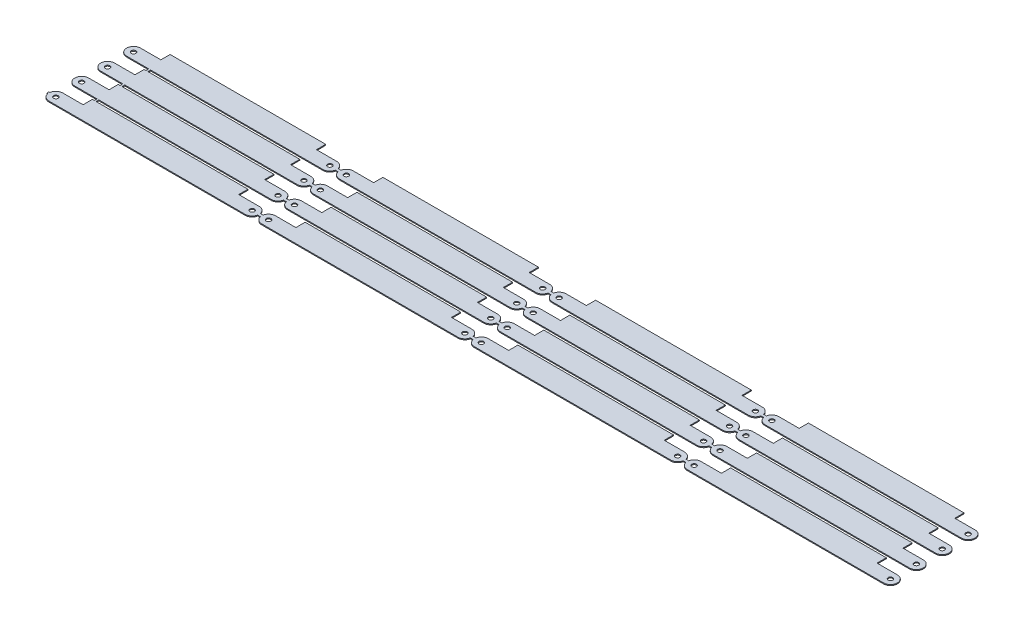
from build123d import *

# Parameters (mm, degrees)
SKETCH1_R           = 2.5
BOSS_EXTRUDE1_DEPTH = 1


with BuildPart() as part:
    # Sketch1 → Boss-Extrude1 (new body)
    with BuildSketch(Plane(origin=(0, 0, 0), x_dir=(1, 0, 0), z_dir=(0, 1, 0))):
        with BuildLine():
            Line((22, 7.5), (0, 7.5))
            ThreePointArc((0, 7.5), (-4.937104415, 5.645794895), (-7.433034374, 1))
            Line((-7.433034374, 1), (-8.5, 1))
            Line((-8.5, 1), (-8.5, -1))
            Line((-8.5, -1), (-7.433034374, -1))
            ThreePointArc((-7.433034374, -1), (-4.937104415, -5.645794895), (0, -7.5))
            Line((0, -7.5), (212.13, -7.5))
            ThreePointArc((212.13, -7.5), (216.87341649, -5.809475019), (219.478469228, -1.5))
            Line((219.478469228, -1.5), (222.551530772, -1.5))
            ThreePointArc((222.551530772, -1.5), (225.15658351, -5.809475019), (229.9, -7.5))
            Line((229.9, -7.5), (442.03, -7.5))
            ThreePointArc((442.03, -7.5), (446.77341649, -5.809475019), (449.378469228, -1.5))
            Line((449.378469228, -1.5), (452.451530772, -1.5))
            ThreePointArc((452.451530772, -1.5), (455.05658351, -5.809475019), (459.8, -7.5))
            Line((459.8, -7.5), (671.93, -7.5))
            ThreePointArc((671.93, -7.5), (676.67341649, -5.809475019), (679.278469228, -1.5))
            Line((679.278469228, -1.5), (682.351530772, -1.5))
            ThreePointArc((682.351530772, -1.5), (684.95658351, -5.809475019), (689.7, -7.5))
            Line((689.7, -7.5), (901.83, -7.5))
            ThreePointArc((901.83, -7.5), (909.33, 0), (901.83, 7.5))
            Line((901.83, 7.5), (879.83, 7.5))
            Line((879.83, 7.5), (879.83, 17.5))
            Line((879.83, 17.5), (711.7, 17.5))
            Line((711.7, 17.5), (711.7, 7.5))
            Line((711.7, 7.5), (689.7, 7.5))
            ThreePointArc((689.7, 7.5), (684.95658351, 5.809475019), (682.351530772, 1.5))
            Line((682.351530772, 1.5), (679.278469228, 1.5))
            ThreePointArc((679.278469228, 1.5), (676.67341649, 5.809475019), (671.93, 7.5))
            Line((671.93, 7.5), (649.93, 7.5))
            Line((649.93, 7.5), (649.93, 17.5))
            Line((649.93, 17.5), (481.8, 17.5))
            Line((481.8, 17.5), (481.8, 7.5))
            Line((481.8, 7.5), (459.8, 7.5))
            ThreePointArc((459.8, 7.5), (455.05658351, 5.809475019), (452.451530772, 1.5))
            Line((452.451530772, 1.5), (449.378469228, 1.5))
            ThreePointArc((449.378469228, 1.5), (446.77341649, 5.809475019), (442.03, 7.5))
            Line((442.03, 7.5), (420.03, 7.5))
            Line((420.03, 7.5), (420.03, 17.5))
            Line((420.03, 17.5), (251.9, 17.5))
            Line((251.9, 17.5), (251.9, 7.5))
            Line((251.9, 7.5), (229.9, 7.5))
            ThreePointArc((229.9, 7.5), (225.15658351, 5.809475019), (222.551530772, 1.5))
            Line((222.551530772, 1.5), (219.478469228, 1.5))
            ThreePointArc((219.478469228, 1.5), (216.87341649, 5.809475019), (212.13, 7.5))
            Line((212.13, 7.5), (190.13, 7.5))
            Line((190.13, 7.5), (190.13, 17.5))
            Line((190.13, 17.5), (26, 17.5))
            Line((26, 17.5), (26, 20.5))
            Line((26, 20.5), (212.13, 20.5))
            ThreePointArc((212.13, 20.5), (216.87341649, 22.190524981), (219.478469228, 26.5))
            Line((219.478469228, 26.5), (222.551530772, 26.5))
            ThreePointArc((222.551530772, 26.5), (225.15658351, 22.190524981), (229.9, 20.5))
            Line((229.9, 20.5), (442.03, 20.5))
            ThreePointArc((442.03, 20.5), (446.77341649, 22.190524981), (449.378469228, 26.5))
            Line((449.378469228, 26.5), (452.451530772, 26.5))
            ThreePointArc((452.451530772, 26.5), (455.05658351, 22.190524981), (459.8, 20.5))
            Line((459.8, 20.5), (671.93, 20.5))
            ThreePointArc((671.93, 20.5), (676.67341649, 22.190524981), (679.278469228, 26.5))
            Line((679.278469228, 26.5), (682.351530772, 26.5))
            ThreePointArc((682.351530772, 26.5), (684.95658351, 22.190524981), (689.7, 20.5))
            Line((689.7, 20.5), (901.83, 20.5))
            ThreePointArc((901.83, 20.5), (909.33, 28), (901.83, 35.5))
            Line((901.83, 35.5), (879.83, 35.5))
            Line((879.83, 35.5), (879.83, 45.5))
            Line((879.83, 45.5), (711.7, 45.5))
            Line((711.7, 45.5), (711.7, 35.5))
            Line((711.7, 35.5), (689.7, 35.5))
            ThreePointArc((689.7, 35.5), (684.95658351, 33.809475019), (682.351530772, 29.5))
            Line((682.351530772, 29.5), (679.278469228, 29.5))
            ThreePointArc((679.278469228, 29.5), (676.67341649, 33.809475019), (671.93, 35.5))
            Line((671.93, 35.5), (649.93, 35.5))
            Line((649.93, 35.5), (649.93, 45.5))
            Line((649.93, 45.5), (481.8, 45.5))
            Line((481.8, 45.5), (481.8, 35.5))
            Line((481.8, 35.5), (459.8, 35.5))
            ThreePointArc((459.8, 35.5), (455.05658351, 33.809475019), (452.451530772, 29.5))
            Line((452.451530772, 29.5), (449.378469228, 29.5))
            ThreePointArc((449.378469228, 29.5), (446.77341649, 33.809475019), (442.03, 35.5))
            Line((442.03, 35.5), (420.03, 35.5))
            Line((420.03, 35.5), (420.03, 45.5))
            Line((420.03, 45.5), (251.9, 45.5))
            Line((251.9, 45.5), (251.9, 35.5))
            Line((251.9, 35.5), (229.9, 35.5))
            ThreePointArc((229.9, 35.5), (225.15658351, 33.809475019), (222.551530772, 29.5))
            Line((222.551530772, 29.5), (219.478469228, 29.5))
            ThreePointArc((219.478469228, 29.5), (216.87341649, 33.809475019), (212.13, 35.5))
            Line((212.13, 35.5), (190.13, 35.5))
            Line((190.13, 35.5), (190.13, 45.5))
            Line((190.13, 45.5), (26, 45.5))
            Line((26, 45.5), (26, 48.5))
            Line((26, 48.5), (212.13, 48.5))
            ThreePointArc((212.13, 48.5), (216.87341649, 50.190524981), (219.478469228, 54.5))
            Line((219.478469228, 54.5), (222.551530772, 54.5))
            ThreePointArc((222.551530772, 54.5), (225.15658351, 50.190524981), (229.9, 48.5))
            Line((229.9, 48.5), (442.03, 48.5))
            ThreePointArc((442.03, 48.5), (446.77341649, 50.190524981), (449.378469228, 54.5))
            Line((449.378469228, 54.5), (452.451530772, 54.5))
            ThreePointArc((452.451530772, 54.5), (455.05658351, 50.190524981), (459.8, 48.5))
            Line((459.8, 48.5), (671.93, 48.5))
            ThreePointArc((671.93, 48.5), (676.67341649, 50.190524981), (679.278469228, 54.5))
            Line((679.278469228, 54.5), (682.351530772, 54.5))
            ThreePointArc((682.351530772, 54.5), (684.95658351, 50.190524981), (689.7, 48.5))
            Line((689.7, 48.5), (901.83, 48.5))
            ThreePointArc((901.83, 48.5), (909.33, 56), (901.83, 63.5))
            Line((901.83, 63.5), (879.83, 63.5))
            Line((879.83, 63.5), (879.83, 73.5))
            Line((879.83, 73.5), (711.7, 73.5))
            Line((711.7, 73.5), (711.7, 63.5))
            Line((711.7, 63.5), (689.7, 63.5))
            ThreePointArc((689.7, 63.5), (684.95658351, 61.809475019), (682.351530772, 57.5))
            Line((682.351530772, 57.5), (679.278469228, 57.5))
            ThreePointArc((679.278469228, 57.5), (676.67341649, 61.809475019), (671.93, 63.5))
            Line((671.93, 63.5), (649.93, 63.5))
            Line((649.93, 63.5), (649.93, 73.5))
            Line((649.93, 73.5), (481.8, 73.5))
            Line((481.8, 73.5), (481.8, 63.5))
            Line((481.8, 63.5), (459.8, 63.5))
            ThreePointArc((459.8, 63.5), (455.05658351, 61.809475019), (452.451530772, 57.5))
            Line((452.451530772, 57.5), (449.378469228, 57.5))
            ThreePointArc((449.378469228, 57.5), (446.77341649, 61.809475019), (442.03, 63.5))
            Line((442.03, 63.5), (420.03, 63.5))
            Line((420.03, 63.5), (420.03, 73.5))
            Line((420.03, 73.5), (251.9, 73.5))
            Line((251.9, 73.5), (251.9, 63.5))
            Line((251.9, 63.5), (229.9, 63.5))
            ThreePointArc((229.9, 63.5), (225.15658351, 61.809475019), (222.551530772, 57.5))
            Line((222.551530772, 57.5), (219.478469228, 57.5))
            ThreePointArc((219.478469228, 57.5), (216.87341649, 61.809475019), (212.13, 63.5))
            Line((212.13, 63.5), (190.13, 63.5))
            Line((190.13, 63.5), (190.13, 73.5))
            Line((190.13, 73.5), (26, 73.5))
            Line((26, 73.5), (26, 76.5))
            Line((26, 76.5), (212.13, 76.5))
            ThreePointArc((212.13, 76.5), (216.87341649, 78.190524981), (219.478469228, 82.5))
            Line((219.478469228, 82.5), (222.551530772, 82.5))
            ThreePointArc((222.551530772, 82.5), (225.15658351, 78.190524981), (229.9, 76.5))
            Line((229.9, 76.5), (442.03, 76.5))
            ThreePointArc((442.03, 76.5), (446.77341649, 78.190524981), (449.378469228, 82.5))
            Line((449.378469228, 82.5), (452.451530772, 82.5))
            ThreePointArc((452.451530772, 82.5), (455.05658351, 78.190524981), (459.8, 76.5))
            Line((459.8, 76.5), (671.93, 76.5))
            ThreePointArc((671.93, 76.5), (676.67341649, 78.190524981), (679.278469228, 82.5))
            Line((679.278469228, 82.5), (682.351530772, 82.5))
            ThreePointArc((682.351530772, 82.5), (684.95658351, 78.190524981), (689.7, 76.5))
            Line((689.7, 76.5), (901.83, 76.5))
            ThreePointArc((901.83, 76.5), (909.33, 84), (901.83, 91.5))
            Line((901.83, 91.5), (879.83, 91.5))
            Line((879.83, 91.5), (879.83, 101.5))
            Line((879.83, 101.5), (711.7, 101.5))
            Line((711.7, 101.5), (711.7, 91.5))
            Line((711.7, 91.5), (689.7, 91.5))
            ThreePointArc((689.7, 91.5), (684.95658351, 89.809475019), (682.351530772, 85.5))
            Line((682.351530772, 85.5), (679.278469228, 85.5))
            ThreePointArc((679.278469228, 85.5), (676.67341649, 89.809475019), (671.93, 91.5))
            Line((671.93, 91.5), (649.93, 91.5))
            Line((649.93, 91.5), (649.93, 101.5))
            Line((649.93, 101.5), (481.8, 101.5))
            Line((481.8, 101.5), (481.8, 91.5))
            Line((481.8, 91.5), (459.8, 91.5))
            ThreePointArc((459.8, 91.5), (455.05658351, 89.809475019), (452.451530772, 85.5))
            Line((452.451530772, 85.5), (449.378469228, 85.5))
            ThreePointArc((449.378469228, 85.5), (446.77341649, 89.809475019), (442.03, 91.5))
            Line((442.03, 91.5), (420.03, 91.5))
            Line((420.03, 91.5), (420.03, 101.5))
            Line((420.03, 101.5), (251.9, 101.5))
            Line((251.9, 101.5), (251.9, 91.5))
            Line((251.9, 91.5), (229.9, 91.5))
            ThreePointArc((229.9, 91.5), (225.15658351, 89.809475019), (222.551530772, 85.5))
            Line((222.551530772, 85.5), (219.478469228, 85.5))
            ThreePointArc((219.478469228, 85.5), (216.87341649, 89.809475019), (212.13, 91.5))
            Line((212.13, 91.5), (190.13, 91.5))
            Line((190.13, 91.5), (190.13, 101.5))
            Line((190.13, 101.5), (22, 101.5))
            Line((22, 101.5), (22, 91.5))
            Line((22, 91.5), (0, 91.5))
            ThreePointArc((0, 91.5), (-7.5, 84), (0, 76.5))
            Line((0, 76.5), (24, 76.5))
            Line((24, 76.5), (24, 73.5))
            Line((24, 73.5), (22, 73.5))
            Line((22, 73.5), (22, 63.5))
            Line((22, 63.5), (0, 63.5))
            ThreePointArc((0, 63.5), (-7.5, 56), (0, 48.5))
            Line((0, 48.5), (24, 48.5))
            Line((24, 48.5), (24, 45.5))
            Line((24, 45.5), (22, 45.5))
            Line((22, 45.5), (22, 35.5))
            Line((22, 35.5), (0, 35.5))
            ThreePointArc((0, 35.5), (-7.5, 28), (0, 20.5))
            Line((0, 20.5), (24, 20.5))
            Line((24, 20.5), (24, 17.5))
            Line((24, 17.5), (22, 17.5))
            Line((22, 17.5), (22, 7.5))
        make_face()
        Circle(SKETCH1_R, mode=Mode.SUBTRACT)
        with Locations((212.13, 0)):
            Circle(SKETCH1_R, mode=Mode.SUBTRACT)
        with Locations((0, 28)):
            Circle(SKETCH1_R, mode=Mode.SUBTRACT)
        with Locations((212.13, 28)):
            Circle(SKETCH1_R, mode=Mode.SUBTRACT)
        with Locations((0, 56)):
            Circle(SKETCH1_R, mode=Mode.SUBTRACT)
        with Locations((212.13, 56)):
            Circle(SKETCH1_R, mode=Mode.SUBTRACT)
        with Locations((0, 84)):
            Circle(SKETCH1_R, mode=Mode.SUBTRACT)
        with Locations((212.13, 84)):
            Circle(SKETCH1_R, mode=Mode.SUBTRACT)
        with Locations((229.9, 84)):
            Circle(SKETCH1_R, mode=Mode.SUBTRACT)
        with Locations((442.03, 84)):
            Circle(SKETCH1_R, mode=Mode.SUBTRACT)
        with Locations((229.9, 56)):
            Circle(SKETCH1_R, mode=Mode.SUBTRACT)
        with Locations((442.03, 56)):
            Circle(SKETCH1_R, mode=Mode.SUBTRACT)
        with Locations((229.9, 28)):
            Circle(SKETCH1_R, mode=Mode.SUBTRACT)
        with Locations((442.03, 28)):
            Circle(SKETCH1_R, mode=Mode.SUBTRACT)
        with Locations((229.9, 0)):
            Circle(SKETCH1_R, mode=Mode.SUBTRACT)
        with Locations((442.03, 0)):
            Circle(SKETCH1_R, mode=Mode.SUBTRACT)
        with Locations((459.8, 84)):
            Circle(SKETCH1_R, mode=Mode.SUBTRACT)
        with Locations((671.93, 84)):
            Circle(SKETCH1_R, mode=Mode.SUBTRACT)
        with Locations((459.8, 56)):
            Circle(SKETCH1_R, mode=Mode.SUBTRACT)
        with Locations((671.93, 56)):
            Circle(SKETCH1_R, mode=Mode.SUBTRACT)
        with Locations((459.8, 28)):
            Circle(SKETCH1_R, mode=Mode.SUBTRACT)
        with Locations((671.93, 28)):
            Circle(SKETCH1_R, mode=Mode.SUBTRACT)
        with Locations((459.8, 0)):
            Circle(SKETCH1_R, mode=Mode.SUBTRACT)
        with Locations((671.93, 0)):
            Circle(SKETCH1_R, mode=Mode.SUBTRACT)
        with Locations((689.7, 84)):
            Circle(SKETCH1_R, mode=Mode.SUBTRACT)
        with Locations((901.83, 84)):
            Circle(SKETCH1_R, mode=Mode.SUBTRACT)
        with Locations((689.7, 56)):
            Circle(SKETCH1_R, mode=Mode.SUBTRACT)
        with Locations((901.83, 56)):
            Circle(SKETCH1_R, mode=Mode.SUBTRACT)
        with Locations((689.7, 28)):
            Circle(SKETCH1_R, mode=Mode.SUBTRACT)
        with Locations((901.83, 28)):
            Circle(SKETCH1_R, mode=Mode.SUBTRACT)
        with Locations((689.7, 0)):
            Circle(SKETCH1_R, mode=Mode.SUBTRACT)
        with Locations((901.83, 0)):
            Circle(SKETCH1_R, mode=Mode.SUBTRACT)
    extrude(amount=BOSS_EXTRUDE1_DEPTH)


solid = part.part
